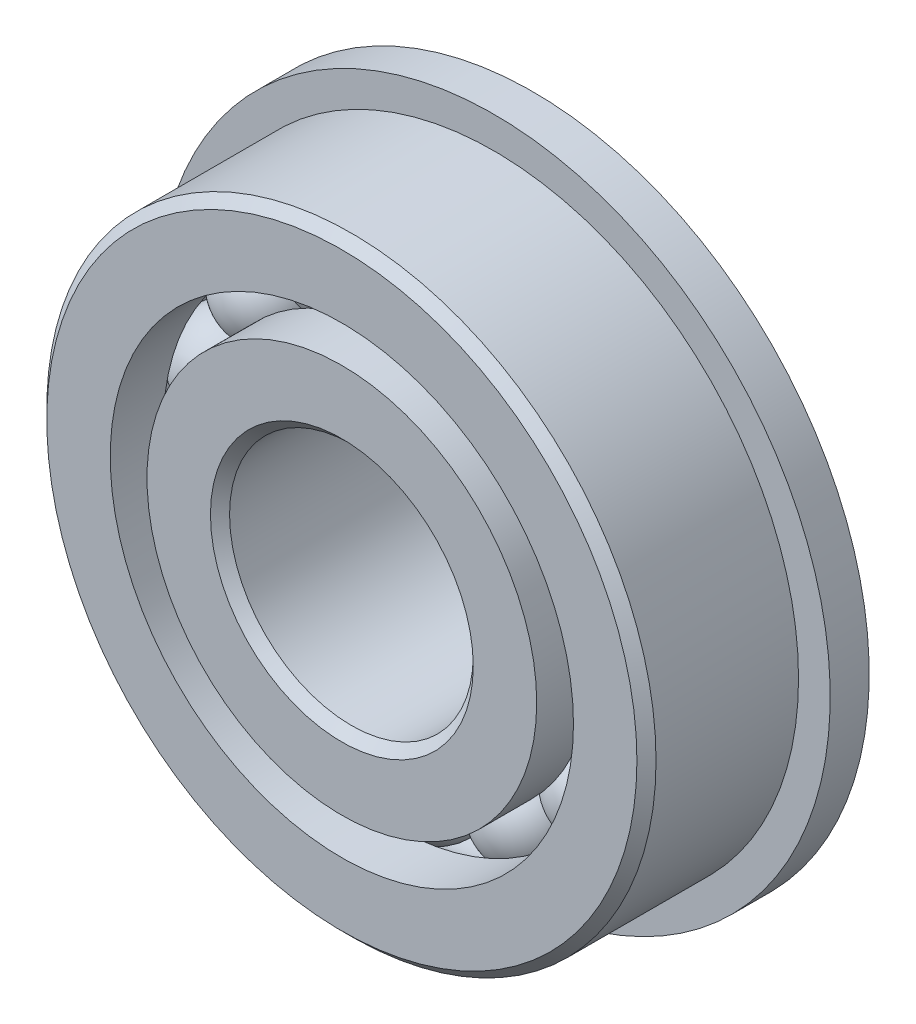
from build123d import *

# Parameters (mm, degrees)
CIRPATTERN1_COUNT = 14
SKETCH6_W         = 1.016
SKETCH6_H         = 2.727778571


with BuildPart() as part:
    # Sketch1 → Revolve1 (revolve)
    with BuildSketch(Plane(origin=(0, 0, 0), x_dir=(0, 0, -1), z_dir=(1, 0, 0))):
        with BuildLine():
            Line((2.24028, 7.9375), (-2.24028, 7.9375))
            Line((-2.24028, 7.9375), (-2.4892, 7.68858))
            Line((-2.4892, 7.68858), (-2.4892, 6.035221429))
            Line((-2.4892, 6.035221429), (-1.106311111, 6.035221429))
            ThreePointArc((-1.106311111, 6.035221429), (0, 6.76179465), (1.106311111, 6.035221429))
            Line((1.106311111, 6.035221429), (2.4892, 6.035221429))
            Line((2.4892, 6.035221429), (2.4892, 7.68858))
            Line((2.4892, 7.68858), (2.24028, 7.9375))
        make_face()
    revolve(axis=Axis((0, 0, 2.4892), (0, 0, -1)))

    # Sketch6 → Revolve6 (revolve)
    with BuildSketch(Plane(origin=(0, 0, 0), x_dir=(0, 0, -1), z_dir=(1, 0, 0))):
        with Locations((1.9812, 7.399110715)):
            Rectangle(SKETCH6_W, SKETCH6_H)
    revolve(axis=Axis((0, 0, -2.4892), (0, 0, 1)))


with BuildPart() as body_2:
    # Sketch3 → Revolve3 (revolve)
    with BuildSketch(Plane(origin=(0, 0, 0), x_dir=(0, 0, -1), z_dir=(1, 0, 0))):
        with BuildLine():
            Line((-2.4892, 5.077278571), (-1.106311111, 5.077278571))
            ThreePointArc((-1.106311111, 5.077278571), (0, 4.35070535), (1.106311111, 5.077278571))
            Line((1.106311111, 5.077278571), (2.4892, 5.077278571))
            Line((2.4892, 5.077278571), (2.4892, 3.42392))
            Line((2.4892, 3.42392), (2.24028, 3.175))
            Line((2.24028, 3.175), (-2.24028, 3.175))
            Line((-2.24028, 3.175), (-2.4892, 3.42392))
            Line((-2.4892, 3.42392), (-2.4892, 5.077278571))
        make_face()
    revolve(axis=Axis((0, 0, 2.4892), (0, 0, -1)))


with BuildPart() as body_3:
    # Sketch4 → Revolve4 (revolve)
    with BuildSketch(Plane(origin=(0, 0, 0), x_dir=(0, 0, -1), z_dir=(1, 0, 0))):
        with BuildLine():
            Line((-1.20554465, 5.55625), (1.20554465, 5.55625))
            ThreePointArc((1.20554465, 5.55625), (0, 6.76179465), (-1.20554465, 5.55625))
        make_face()
    revolve(axis=Axis((0, 5.55625, 1.20554465), (0, 0, -1)))


with BuildPart() as cirpattern1_1:
    # CirPattern1: pattern copy
    add(body_3.part.rotate(Axis((0, 0, -2.4892), (0, 0, 1)), 1 * 360 / CIRPATTERN1_COUNT))


with BuildPart() as cirpattern1_2:
    # CirPattern1: pattern copy
    add(body_3.part.rotate(Axis((0, 0, -2.4892), (0, 0, 1)), 2 * 360 / CIRPATTERN1_COUNT))


with BuildPart() as cirpattern1_3:
    # CirPattern1: pattern copy
    add(body_3.part.rotate(Axis((0, 0, -2.4892), (0, 0, 1)), 3 * 360 / CIRPATTERN1_COUNT))


with BuildPart() as cirpattern1_4:
    # CirPattern1: pattern copy
    add(body_3.part.rotate(Axis((0, 0, -2.4892), (0, 0, 1)), 4 * 360 / CIRPATTERN1_COUNT))


with BuildPart() as cirpattern1_5:
    # CirPattern1: pattern copy
    add(body_3.part.rotate(Axis((0, 0, -2.4892), (0, 0, 1)), 5 * 360 / CIRPATTERN1_COUNT))


with BuildPart() as cirpattern1_6:
    # CirPattern1: pattern copy
    add(body_3.part.rotate(Axis((0, 0, -2.4892), (0, 0, 1)), 6 * 360 / CIRPATTERN1_COUNT))


with BuildPart() as cirpattern1_7:
    # CirPattern1: pattern copy
    add(body_3.part.rotate(Axis((0, 0, -2.4892), (0, 0, 1)), 7 * 360 / CIRPATTERN1_COUNT))


with BuildPart() as cirpattern1_8:
    # CirPattern1: pattern copy
    add(body_3.part.rotate(Axis((0, 0, -2.4892), (0, 0, 1)), 8 * 360 / CIRPATTERN1_COUNT))


with BuildPart() as cirpattern1_9:
    # CirPattern1: pattern copy
    add(body_3.part.rotate(Axis((0, 0, -2.4892), (0, 0, 1)), 9 * 360 / CIRPATTERN1_COUNT))


with BuildPart() as cirpattern1_10:
    # CirPattern1: pattern copy
    add(body_3.part.rotate(Axis((0, 0, -2.4892), (0, 0, 1)), 10 * 360 / CIRPATTERN1_COUNT))


with BuildPart() as cirpattern1_11:
    # CirPattern1: pattern copy
    add(body_3.part.rotate(Axis((0, 0, -2.4892), (0, 0, 1)), 11 * 360 / CIRPATTERN1_COUNT))


with BuildPart() as cirpattern1_12:
    # CirPattern1: pattern copy
    add(body_3.part.rotate(Axis((0, 0, -2.4892), (0, 0, 1)), 12 * 360 / CIRPATTERN1_COUNT))


with BuildPart() as cirpattern1_13:
    # CirPattern1: pattern copy
    add(body_3.part.rotate(Axis((0, 0, -2.4892), (0, 0, 1)), 13 * 360 / CIRPATTERN1_COUNT))


solid = Compound([part.part, body_2.part, body_3.part, cirpattern1_1.part, cirpattern1_2.part, cirpattern1_3.part, cirpattern1_4.part, cirpattern1_5.part, cirpattern1_6.part, cirpattern1_7.part, cirpattern1_8.part, cirpattern1_9.part, cirpattern1_10.part, cirpattern1_11.part, cirpattern1_12.part, cirpattern1_13.part])
